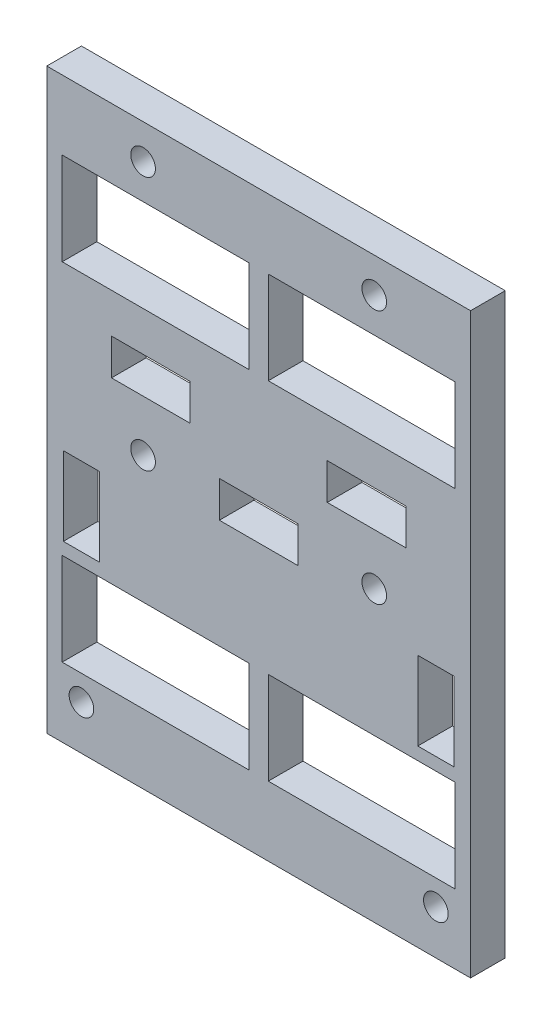
from build123d import *

# Parameters (mm, degrees)
SKETCH1_W           = 55
SKETCH1_H           = 75
SKETCH1_W_2         = 24.25
SKETCH1_H_2         = 12
BOSS_EXTRUDE1_DEPTH = 4.5
SKETCH2_R           = 1.6
SCREWHOLES_DEPTH    = 47.719910103
SKETCH3_W           = 10.2
SKETCH3_H           = 4.7
BELTCLAMP_DEPTH     = 47.719910103
SKETCH4_W           = 10.2
SKETCH4_H           = 4.7
CUT_EXTRUDE3_DEPTH  = 47.719910103
SKETCH5_R           = 1.6
SKETCH5_W           = 4.7
SKETCH5_H           = 10.2
CUT_EXTRUDE4_DEPTH  = 47.719910103


with BuildPart() as part:
    # Sketch1 → Boss-Extrude1 (new body)
    with BuildSketch(Plane.XY):
        Rectangle(SKETCH1_W, SKETCH1_H)
        with Locations((-13.375, 22.5)):
            Rectangle(SKETCH1_W_2, SKETCH1_H_2, mode=Mode.SUBTRACT)
        with Locations((13.375, 22.5)):
            Rectangle(SKETCH1_W_2, SKETCH1_H_2, mode=Mode.SUBTRACT)
        with Locations((13.375, -22.5)):
            Rectangle(SKETCH1_W_2, SKETCH1_H_2, mode=Mode.SUBTRACT)
        with Locations((-13.375, -22.5)):
            Rectangle(SKETCH1_W_2, SKETCH1_H_2, mode=Mode.SUBTRACT)
    extrude(amount=BOSS_EXTRUDE1_DEPTH)

    # Sketch2 → screwHoles (cut, through all)
    with BuildSketch(Plane.XY.offset(4.5)):
        with Locations((-15, 33)):
            Circle(SKETCH2_R)
        with Locations((15, 33)):
            Circle(SKETCH2_R)
        with Locations((15, 0)):
            Circle(SKETCH2_R)
        with Locations((-15, 0)):
            Circle(SKETCH2_R)
    extrude(amount=-SCREWHOLES_DEPTH, mode=Mode.SUBTRACT)

    # Sketch3 → BeltClamp (cut, through all)
    with BuildSketch(Plane.XY.offset(4.5)):
        with Locations((-14, 9)):
            Rectangle(SKETCH3_W, SKETCH3_H)
        with Locations((14, 9)):
            Rectangle(SKETCH3_W, SKETCH3_H)
    extrude(amount=-BELTCLAMP_DEPTH, mode=Mode.SUBTRACT)

    # Sketch4 → Cut-Extrude3 (cut, through all)
    with BuildSketch(Plane.XY.offset(4.5)):
        Rectangle(SKETCH4_W, SKETCH4_H)
    extrude(amount=-CUT_EXTRUDE3_DEPTH, mode=Mode.SUBTRACT)

    # Sketch5 → Cut-Extrude4 (cut, through all)
    with BuildSketch(Plane.XY.offset(4.5)):
        with Locations((23, -31.75)):
            Circle(SKETCH5_R)
        with Locations((-23, -31.75)):
            Circle(SKETCH5_R)
        with Locations((23, -9.75)):
            Rectangle(SKETCH5_W, SKETCH5_H)
        with Locations((-23, -9.75)):
            Rectangle(SKETCH5_W, SKETCH5_H)
    extrude(amount=-CUT_EXTRUDE4_DEPTH, mode=Mode.SUBTRACT)


solid = part.part
